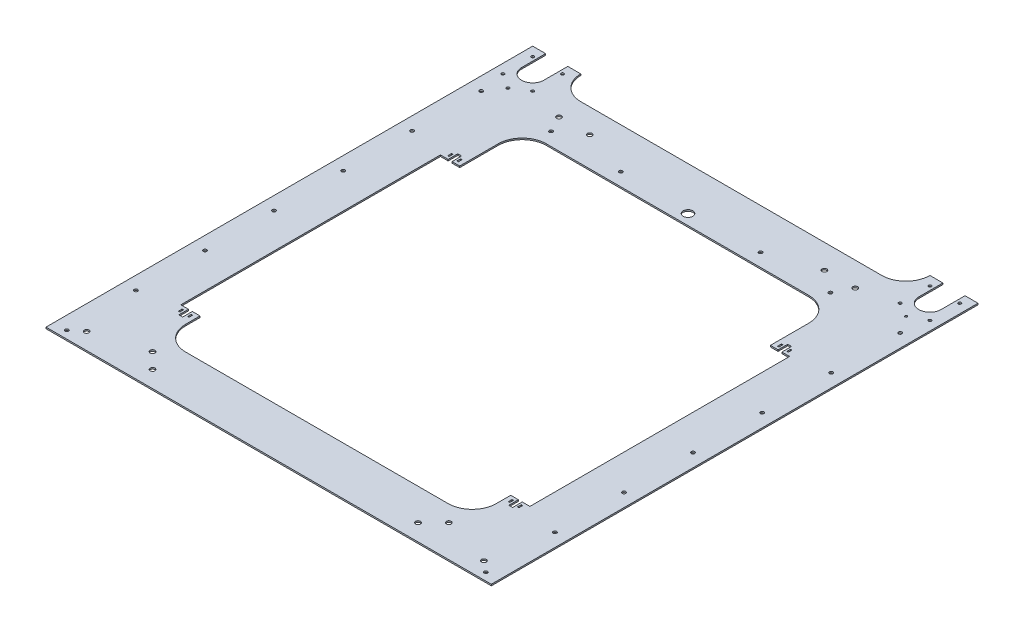
from build123d import *

# Parameters (mm, degrees)
SKETCH24_W               = 463
SKETCH24_H               = 506
BASE_FLANGE1_DEPTH       = 1.51892
SKETCH33_W               = 1.5
SKETCH33_H               = 4
SKETCH33_R               = 2.5
SKETCH33_R_2             = 1.5
SKETCH33_R_3             = 5
CUT_EXTRUDE1_DEPTH       = 1.51892
SKETCH35_R               = 1.513178902
SKETCH35_R_2             = 1.149873802
CUT_EXTRUDE3_DEPTH       = 10
M3_CLEARANCE_HOLE1_D     = 3.6
M3_CLEARANCE_HOLE1_DEPTH = 11.938
M3_CLEARANCE_HOLE1_TIP   = 1.081549114


# Sheet-metal steps are written as plain solids
with BuildPart() as part:
    # Sketch24 → Base-Flange1 (new body)
    with BuildSketch(Plane(origin=(0, 0, 0), x_dir=(1, 0, 0), z_dir=(0, 1, 0))):
        with Locations((0, -172.1425)):
            Rectangle(SKETCH24_W, SKETCH24_H)
    extrude(amount=-BASE_FLANGE1_DEPTH)

    # Sketch33 → Cut-Extrude1 (cut)
    with BuildSketch(Plane.XZ.offset(1.51892)):
        with BuildLine():
            Line((136.5, 375), (-136.5, 375))
            ThreePointArc((-136.5, 375), (-154.17766953, 367.67766953), (-161.5, 350))
            Line((-161.5, 350), (-161.5, 335))
            Line((-161.5, 335), (-169.5, 335))
            Line((-169.5, 335), (-169.5, 345))
            Line((-169.5, 345), (-173.5, 345))
            Line((-173.5, 345), (-173.5, 335))
            Line((-173.5, 335), (-181.5, 335))
            Line((-181.5, 335), (-181.5, 65))
            Line((-181.5, 65), (-173.5, 65))
            Line((-173.5, 65), (-173.5, 55))
            Line((-173.5, 55), (-169.5, 55))
            Line((-169.5, 55), (-169.5, 65))
            Line((-169.5, 65), (-161.5, 65))
            Line((-161.5, 65), (-161.5, 25))
            ThreePointArc((-161.5, 25), (-154.17766953, 7.32233047), (-136.5, 0))
            Line((-136.5, 0), (136.5, 0))
            ThreePointArc((136.5, 0), (154.17766953, 7.32233047), (161.5, 25))
            Line((161.5, 25), (161.5, 65))
            Line((161.5, 65), (169.5, 65))
            Line((169.5, 65), (169.5, 55))
            Line((169.5, 55), (173.5, 55))
            Line((173.5, 55), (173.5, 65))
            Line((173.5, 65), (181.5, 65))
            Line((181.5, 65), (181.5, 335))
            Line((181.5, 335), (173.5, 335))
            Line((173.5, 335), (173.5, 345))
            Line((173.5, 345), (169.5, 345))
            Line((169.5, 345), (169.5, 335))
            Line((169.5, 335), (161.5, 335))
            Line((161.5, 335), (161.5, 350))
            ThreePointArc((161.5, 350), (154.17766953, 367.67766953), (136.5, 375))
        make_face()
        with Locations((-176.25, 60)):
            Rectangle(SKETCH33_W, SKETCH33_H)
        with Locations((-166.75, 60)):
            Rectangle(SKETCH33_W, SKETCH33_H)
        with Locations((176.25, 60)):
            Rectangle(SKETCH33_W, SKETCH33_H)
        with Locations((166.75, 60)):
            Rectangle(SKETCH33_W, SKETCH33_H)
        with Locations((176.25, 340)):
            Rectangle(SKETCH33_W, SKETCH33_H)
        with Locations((166.75, 340)):
            Rectangle(SKETCH33_W, SKETCH33_H)
        with Locations((-166.75, 340)):
            Rectangle(SKETCH33_W, SKETCH33_H)
        with Locations((-176.25, 340)):
            Rectangle(SKETCH33_W, SKETCH33_H)
        with BuildLine():
            Line((195, -55.8575), (195, -80.8575))
            Line((195, -80.8575), (218, -80.8575))
            Line((218, -80.8575), (218, -55.8575))
            ThreePointArc((218, -55.8575), (206.5, -44.3575), (195, -55.8575))
        make_face()
        with BuildLine():
            ThreePointArc((-156.5, -55.8575), (-174.17766953, -63.17983047), (-181.5, -80.8575))
            Line((-181.5, -80.8575), (181.5, -80.8575))
            ThreePointArc((181.5, -80.8575), (174.17766953, -63.17983047), (156.5, -55.8575))
            Line((156.5, -55.8575), (-156.5, -55.8575))
        make_face()
        with BuildLine():
            Line((-218, -55.8575), (-218, -80.8575))
            Line((-218, -80.8575), (-195, -80.8575))
            Line((-195, -80.8575), (-195, -55.8575))
            ThreePointArc((-195, -55.8575), (-206.5, -44.3575), (-218, -55.8575))
        make_face()
        with Locations(Location((-206.5, 407.8575, 0), (0, 0, 270))):
            Circle(SKETCH33_R)
        with Locations(Location((-154, 391.8575, 0), (0, 0, 270))):
            Circle(SKETCH33_R)
        with Locations(Location((-138, 407.8575, 0), (0, 0, 270))):
            Circle(SKETCH33_R)
        with Locations(Location((138, 407.8575, 0), (0, 0, 270))):
            Circle(SKETCH33_R)
        with Locations(Location((154, 391.8575, 0), (0, 0, 270))):
            Circle(SKETCH33_R)
        with Locations(Location((206.5, 407.8575, 0), (0, 0, 270))):
            Circle(SKETCH33_R)
        with Locations(Location((154, -30.715, 0), (0, 0, 270))):
            Circle(SKETCH33_R)
        with Locations(Location((122, -30.715, 0), (0, 0, 270))):
            Circle(SKETCH33_R)
        with Locations(Location((191, -40.3575, 0), (0, 0, 270))):
            Circle(SKETCH33_R_2)
        with Locations(Location((191, -71.3575, 0), (0, 0, 270))):
            Circle(SKETCH33_R_2)
        with Locations(Location((222, -40.3575, 0), (0, 0, 270))):
            Circle(SKETCH33_R_2)
        with Locations(Location((222, -71.3575, 0), (0, 0, 270))):
            Circle(SKETCH33_R_2)
        with Locations(Location((-154, -30.715, 0), (0, 0, 270))):
            Circle(SKETCH33_R)
        with Locations(Location((-122, -30.715, 0), (0, 0, 270))):
            Circle(SKETCH33_R)
        with Locations(Location((-222, -40.3575, 0), (0, 0, 270))):
            Circle(SKETCH33_R_2)
        with Locations(Location((-222, -71.3575, 0), (0, 0, 270))):
            Circle(SKETCH33_R_2)
        with Locations(Location((-191, -71.3575, 0), (0, 0, 270))):
            Circle(SKETCH33_R_2)
        with Locations(Location((-191, -40.3575, 0), (0, 0, 270))):
            Circle(SKETCH33_R_2)
        with Locations(Location((0, -10.8575, 0), (0, 0, 270))):
            Circle(SKETCH33_R_3)
    extrude(amount=-CUT_EXTRUDE1_DEPTH, mode=Mode.SUBTRACT)

    # Sketch35 → Cut-Extrude3 (cut)
    with BuildSketch(Plane.XZ.offset(1.51892)):
        with Locations(Location((-206.607994526, -30.137642513, 0), (0, 0, 270))):
            Circle(SKETCH35_R)
        with Locations(Location((205.958496696, -31.650821415, 0), (0, 0, 270))):
            Circle(SKETCH35_R_2)
    extrude(amount=-CUT_EXTRUDE3_DEPTH, mode=Mode.SUBTRACT)

    # M3 Clearance Hole1
    with Locations(Plane(origin=(0, -1.51892, 0), x_dir=(-1, 0, 0), z_dir=(0, -1, 0))):
        with Locations((217.84, -417.1425), (-217.8375, -417.1425), (217.84, -345.341666667), (217.84, -273.540833333), (217.84, -201.74), (217.84, -129.939166667), (217.84, -58.138333333), (-217.8375, -58.138333333), (-217.8375, -129.939166667), (-217.8375, -201.74), (-217.8375, -273.540833333), (-217.8375, -345.341666667), (145.227083333, 13.6625), (72.614166667, 13.6625), (0.00125, 13.6625), (-72.611666667, 13.6625), (-145.224583333, 13.6625), (217.84, 13.6625), (-217.8375, 13.6625)):
            Hole(M3_CLEARANCE_HOLE1_D / 2, depth=M3_CLEARANCE_HOLE1_DEPTH)
            with Locations((0, 0, -(M3_CLEARANCE_HOLE1_DEPTH + M3_CLEARANCE_HOLE1_TIP / 2))):  # 118° drill point
                Cone(0, M3_CLEARANCE_HOLE1_D / 2, M3_CLEARANCE_HOLE1_TIP, mode=Mode.SUBTRACT)


solid = part.part
